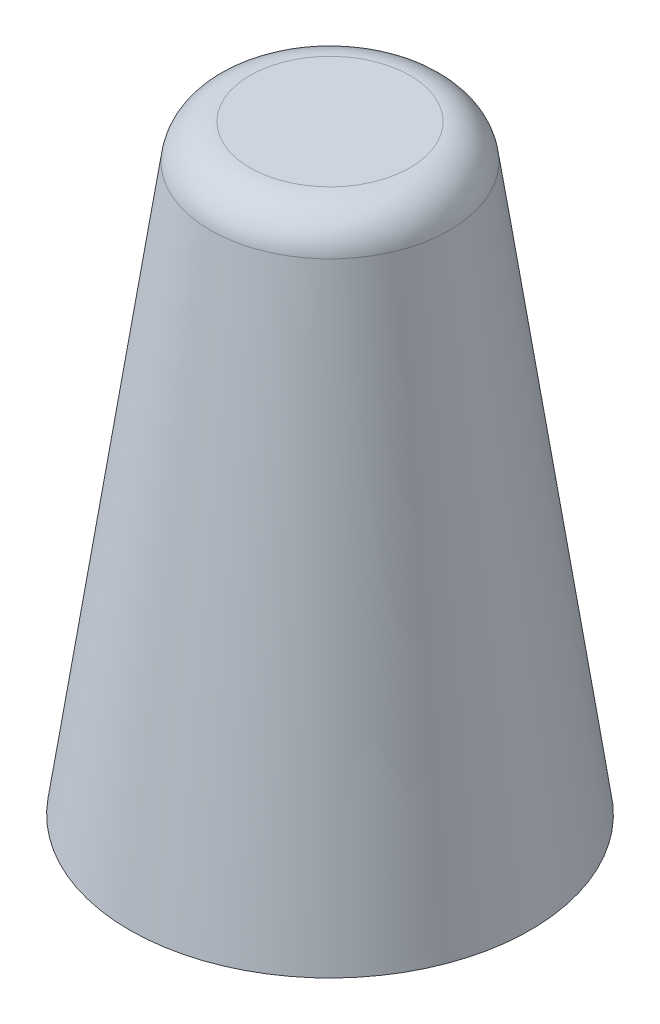
from build123d import *

# Parameters (mm, degrees)
SKETCH2_R           = 1.65
SKETCH2_R_2         = 0.65
BOSS_EXTRUDE1_DEPTH = 14
FILLET1_R           = 1


with BuildPart() as part:
    # Sketch2 → Boss-Extrude1 (new body)
    with BuildSketch(Plane(origin=(0, 0, 0), x_dir=(1, 0, 0), z_dir=(0, 1, 0))):
        with Locations(Location((0, 0, 0), (0, 0, 270))):
            Circle(SKETCH2_R)
        with Locations(Location((0, 0, 0), (0, 0, 270))):
            Circle(SKETCH2_R_2, mode=Mode.SUBTRACT)
    extrude(amount=BOSS_EXTRUDE1_DEPTH)

    # Sketch4 → Revolve1 (revolve)
    with BuildSketch(Plane.XY, mode=Mode.PRIVATE) as revolve1_sk:
        Polygon((2, 14), (4, 0), (5.010152545, 0), (3.010152545, 14), align=None)
        Polygon((2.867295402, 15), (3.010152545, 14), (0, 14), (0, 15), align=None)
    revolve(revolve1_sk.sketch.rotate(Axis((0, 0, 0), (0, 1, 0)), 90), axis=Axis((0, 0, 0), (0, 1, 0)))

    # Chamfer1: read off the stored shape, not the designer's step
    # Chamfer1 outline → Chamfer1 (revolve)
    with BuildSketch(Plane.XY):
        Polygon((1.65, 9), (2.58125, 9.93125), (2.58125, 14), (1.65, 14), align=None)
    revolve(axis=Axis((0, 0, 0), (0, 1, 0)))

    # Fillet1
    fillet1_edges = [part.edges().sort_by_distance(p)[0] for p in [
        (0, 15, 2.867295402),
    ]]
    fillet(fillet1_edges, radius=FILLET1_R)


solid = part.part
